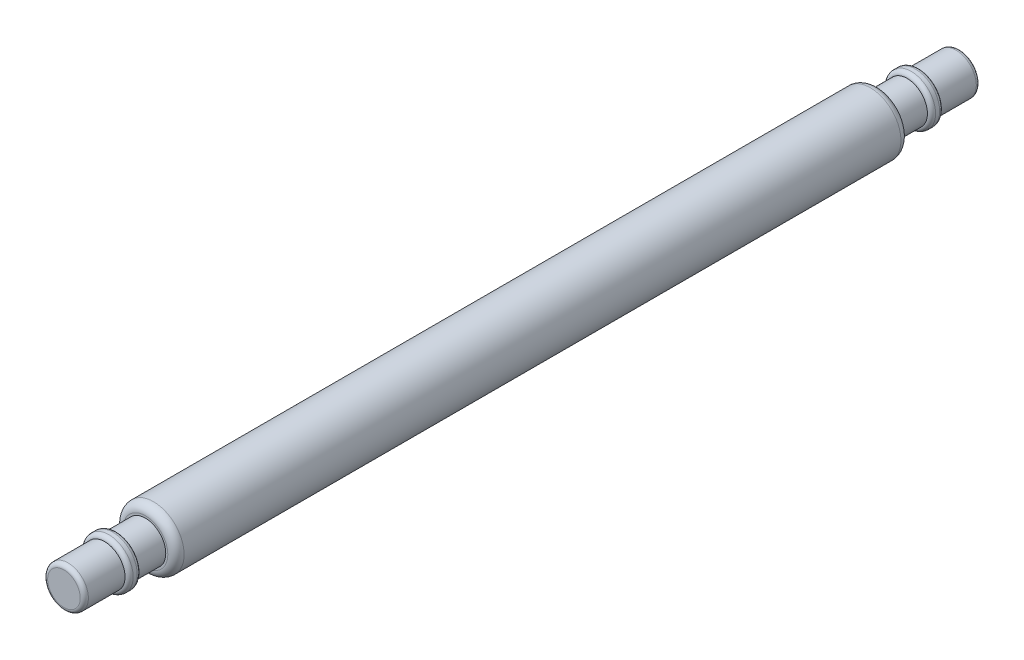
from build123d import *

# Parameters (mm, degrees)
SKETCH1_R           = 0.75
BOSS_EXTRUDE1_DEPTH = 11
SKETCH2_R           = 1.389423691
SKETCH2_R_2         = 0.5
CUT_EXTRUDE1_DEPTH  = 2
CUT_EXTRUDE2_START  = -2
SKETCH3_R           = 1.153055404
SKETCH3_R_2         = 0.5
CUT_EXTRUDE2_DEPTH  = 2
BOSS_EXTRUDE2_START = -1.3
SKETCH4_R           = 0.6
SKETCH4_R_2         = 0.5
BOSS_EXTRUDE2_DEPTH = 0.3
FILLET1_R           = 0.2
FILLET2_R           = 0.1
FILLET3_R           = 0.1


with BuildPart() as part:
    # Sketch1 → Boss-Extrude1 (new, symmetric)
    with BuildSketch(Plane.XY):
        Circle(SKETCH1_R)
    extrude(amount=BOSS_EXTRUDE1_DEPTH, both=True)

    # Sketch2 → Cut-Extrude1 (cut)
    with BuildSketch(Plane.XY.offset(11)):
        Circle(SKETCH2_R)
        Circle(SKETCH2_R_2, mode=Mode.SUBTRACT)
    extrude(amount=-CUT_EXTRUDE1_DEPTH, mode=Mode.SUBTRACT)

    # Sketch3 → Cut-Extrude2 (cut)
    with BuildSketch(Plane(origin=(0, 0, -11), x_dir=(-1, 0, 0), z_dir=(0, 0, -1)).offset(CUT_EXTRUDE2_START)):
        Circle(SKETCH3_R)
        with Locations(Location((0, 0, 0), (0, 0, 180))):
            Circle(SKETCH3_R_2, mode=Mode.SUBTRACT)
    extrude(amount=CUT_EXTRUDE2_DEPTH, mode=Mode.SUBTRACT)

    # Sketch4 → Boss-Extrude2 (add)
    with BuildSketch(Plane(origin=(0, 0, -11), x_dir=(-1, 0, 0), z_dir=(0, 0, -1)).offset(BOSS_EXTRUDE2_START)):
        Circle(SKETCH4_R)
        Circle(SKETCH4_R_2, mode=Mode.SUBTRACT)
    boss_extrude2 = extrude(amount=BOSS_EXTRUDE2_DEPTH)

    # Fillet1
    fillet1_edges = [part.edges().sort_by_distance(p)[0] for p in [
        (-0.75, 0, -9),
        (-0.75, 0, 9),
    ]]
    fillet(fillet1_edges, radius=FILLET1_R)

    # Fillet2
    fillet2_edges = [part.edges().sort_by_distance(p)[0] for p in [
        (-0.5, 0, -11),
        (0.6, 0, -9.7),
        (0.6, 0, -10),
    ]]
    fillet(fillet2_edges, radius=FILLET2_R - 0.0001)  # a hair under: the kernel refuses the full size

    # Mirror1: Boss-Extrude2 across plane
    add(boss_extrude2.mirror(Plane.XY))

    # Fillet3
    fillet3_edges = [part.edges().sort_by_distance(p)[0] for p in [
        (0.6, 0, 9.7),
        (0.6, 0, 10),
        (-0.5, 0, 11),
    ]]
    fillet(fillet3_edges, radius=FILLET3_R - 0.0001)  # a hair under: the kernel refuses the full size


solid = part.part
